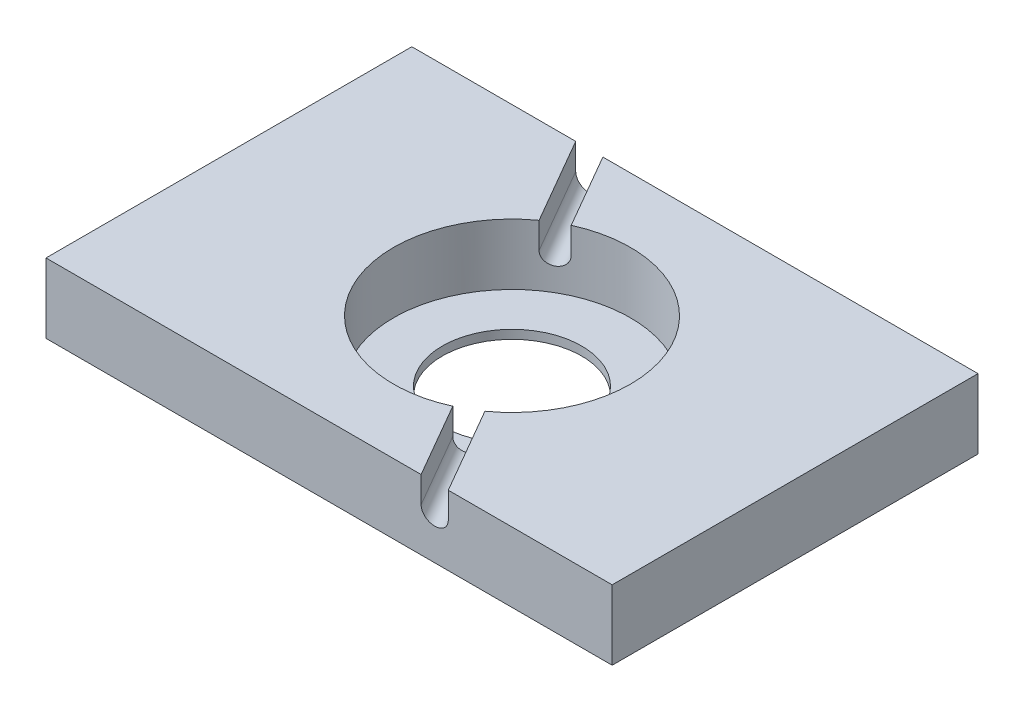
from build123d import *

# Parameters (mm, degrees)
SCHIZZO1_R                        = 27
ESTRUSIONE_ESTRUSIONE1_DEPTH      = 1
SCHIZZO2_R                        = 8
TAGLIO_ESTRUSIONE1_DEPTH          = 39.19685851
SCHIZZO3_R                        = 27
SCHIZZO3_R_2                      = 13.6
ESTRUSIONE_ESTRUSIONE2_DEPTH      = 5
ESTRUSIONE_ESTRUSIONE3_DEPTH      = 2
ESTRUSIONE_ESTRUSIONE3_DEPTH_BACK = 1
SCHIZZO5_W                        = 65
SCHIZZO5_H                        = 42
SCHIZZO5_R                        = 13.6
TAGLIO_ESTRUSIONE2_DEPTH          = 43.547032799
TAGLIO_ESTRUSIONE2_DEPTH_BACK     = 43.547032799
SCHIZZO3D1_R                      = 1.35
TAGLIO_ESTRUSIONE3_DEPTH          = 44.869308585
TAGLIO_ESTRUSIONE3_DEPTH_BACK     = 44.869308585
SCHIZZO8_W                        = 81.46070362
SCHIZZO8_H                        = 59.010327036
SCHIZZO8_W_2                      = 65
SCHIZZO8_H_2                      = 42
TAGLIO_ESTRUSIONE5_DEPTH          = 43.676105804
SCHIZZO10_W                       = 15.529437252
SCHIZZO10_H                       = 42
ESTRUSIONE_ESTRUSIONE4_DEPTH      = 5
SCHIZZO11_W                       = 15.529437252
SCHIZZO11_H                       = 42
ESTRUSIONE_ESTRUSIONE5_DEPTH      = 5


with BuildPart() as part:
    # Schizzo1 → Estrusione-Estrusione1 (new body)
    with BuildSketch(Plane(origin=(0, 0, 0), x_dir=(1, 0, 0), z_dir=(0, 1, 0))):
        Circle(SCHIZZO1_R)
    extrude(amount=ESTRUSIONE_ESTRUSIONE1_DEPTH)

    # Schizzo2 → Taglio-Estrusione1 (cut, through all)
    with BuildSketch(Plane(origin=(0, 1, 0), x_dir=(1, 0, 0), z_dir=(0, 1, 0))):
        Circle(SCHIZZO2_R)
    extrude(amount=-TAGLIO_ESTRUSIONE1_DEPTH, mode=Mode.SUBTRACT)

    # Schizzo3 → Estrusione-Estrusione2 (add)
    with BuildSketch(Plane(origin=(0, 1, 0), x_dir=(1, 0, 0), z_dir=(0, 1, 0))):
        Circle(SCHIZZO3_R)
        Circle(SCHIZZO3_R_2, mode=Mode.SUBTRACT)
    extrude(amount=ESTRUSIONE_ESTRUSIONE2_DEPTH)

    # Schizzo5 → Estrusione-Estrusione3 (add, two sides: drawn at the far end of the back side and taken through both)
    with BuildSketch(Plane(origin=(0, 6, 0), x_dir=(1, 0, 0), z_dir=(0, 1, 0)).offset(-ESTRUSIONE_ESTRUSIONE3_DEPTH_BACK)):
        Rectangle(SCHIZZO5_W, SCHIZZO5_H)
        Circle(SCHIZZO5_R, mode=Mode.SUBTRACT)
    extrude(amount=ESTRUSIONE_ESTRUSIONE3_DEPTH + ESTRUSIONE_ESTRUSIONE3_DEPTH_BACK)

    # Schizzo3D1 → Taglio-Estrusione2 (cut, two sides: drawn at the far end of the back side and taken through both)
    with BuildSketch(Plane(origin=(0, 5, 0), x_dir=(-0.8660254037844382, 0, 0.500000000000001), z_dir=(-0.500000000000001, 0, -0.866025403784438)).offset(-TAGLIO_ESTRUSIONE2_DEPTH_BACK)):
        Circle(SCHIZZO3D1_R)
    extrude(amount=TAGLIO_ESTRUSIONE2_DEPTH + TAGLIO_ESTRUSIONE2_DEPTH_BACK, mode=Mode.SUBTRACT)

    # Schizzo3D2 → Taglio-Estrusione3 (cut, two sides: drawn at the far end of the back side and taken through both)
    with BuildSketch(Plane(origin=(1.169134295, 5, -0.675), x_dir=(-0.41149103074101084, 0.8799053976571924, 0.23757445736745078), z_dir=(-0.5000000000000011, 1.0747888534457561e-14, -0.866025403784438)).offset(-TAGLIO_ESTRUSIONE3_DEPTH_BACK)):
        Polygon((0, 0), (1.28290207, -2.375744574), (5.682429058, 0), (4.399526988, 2.375744574), align=None)
    extrude(amount=TAGLIO_ESTRUSIONE3_DEPTH + TAGLIO_ESTRUSIONE3_DEPTH_BACK, mode=Mode.SUBTRACT)

    # Schizzo8 → Taglio-Estrusione5 (cut, through all)
    with BuildSketch(Plane(origin=(0, 6, 0), x_dir=(1, 0, 0), z_dir=(0, 1, 0))):
        Rectangle(SCHIZZO8_W, SCHIZZO8_H)
        Rectangle(SCHIZZO8_W_2, SCHIZZO8_H_2, mode=Mode.SUBTRACT)
    extrude(amount=-TAGLIO_ESTRUSIONE5_DEPTH, mode=Mode.SUBTRACT)

    # Schizzo10 → Estrusione-Estrusione4 (add)
    with BuildSketch(Plane.XZ.offset(-5)):
        with Locations((-24.735281374, 0)):
            Rectangle(SCHIZZO10_W, SCHIZZO10_H)
    extrude(amount=ESTRUSIONE_ESTRUSIONE4_DEPTH)

    # Schizzo11 → Estrusione-Estrusione5 (add)
    with BuildSketch(Plane.XZ.offset(-5)):
        with Locations((24.735281374, 0)):
            Rectangle(SCHIZZO11_W, SCHIZZO11_H)
    extrude(amount=ESTRUSIONE_ESTRUSIONE5_DEPTH)


solid = part.part
